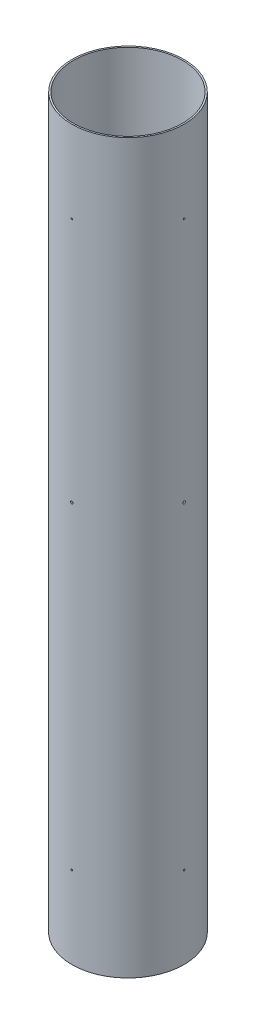
from build123d import *

# Parameters (mm, degrees)
SKETCH1_R           = 78.359
SKETCH1_R_2         = 76.1746
BOSS_EXTRUDE1_DEPTH = 1016
SKETCH3_R           = 1.750000056
SKETCH3_R_2         = 1.0922
CUT_EXTRUDE1_DEPTH  = 1023.025570014
CIRPATTERN1_COUNT   = 4


with BuildPart() as part:
    # Sketch1 → Boss-Extrude1 (new body)
    with BuildSketch(Plane(origin=(0, 0, 0), x_dir=(1, 0, 0), z_dir=(0, 1, 0))):
        Circle(SKETCH1_R)
        Circle(SKETCH1_R_2, mode=Mode.SUBTRACT)
    extrude(amount=BOSS_EXTRUDE1_DEPTH)

    # Sketch3 → Cut-Extrude1 (cut, through all)
    with BuildSketch(Plane.XY):
        with Locations((0, 558.8)):
            Circle(SKETCH3_R)
        with Locations((0, 114.3)):
            Circle(SKETCH3_R_2)
        with Locations((0, 901.7)):
            Circle(SKETCH3_R_2)
    cut_extrude1 = extrude(amount=-CUT_EXTRUDE1_DEPTH, mode=Mode.SUBTRACT)

    # CirPattern1: Cut-Extrude1 ×4 about axis
    cirpattern1_axis = Axis((0, 1016, 0), (0, -1, 0))
    for i in range(1, CIRPATTERN1_COUNT):
        add(cut_extrude1.rotate(cirpattern1_axis, i * 360 / CIRPATTERN1_COUNT), mode=Mode.SUBTRACT)


solid = part.part
